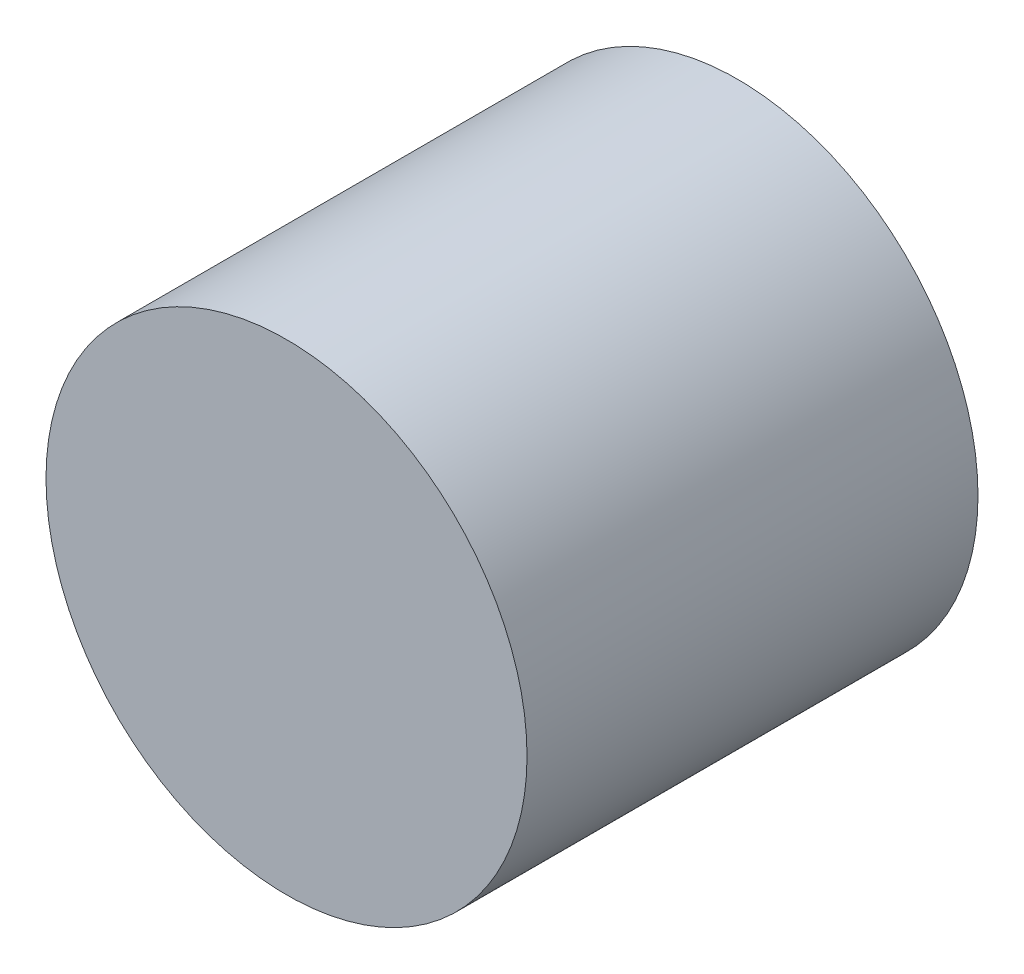
from build123d import *

# Parameters (mm, degrees)
SKETCH_1_R      = 16
EXTRUDE_1_DEPTH = 15


with BuildPart() as part:
    # 草图1 → 凸台-拉伸1 (new, symmetric)
    with BuildSketch(Plane.XY):
        Circle(SKETCH_1_R)
    extrude(amount=EXTRUDE_1_DEPTH, both=True)


solid = part.part
